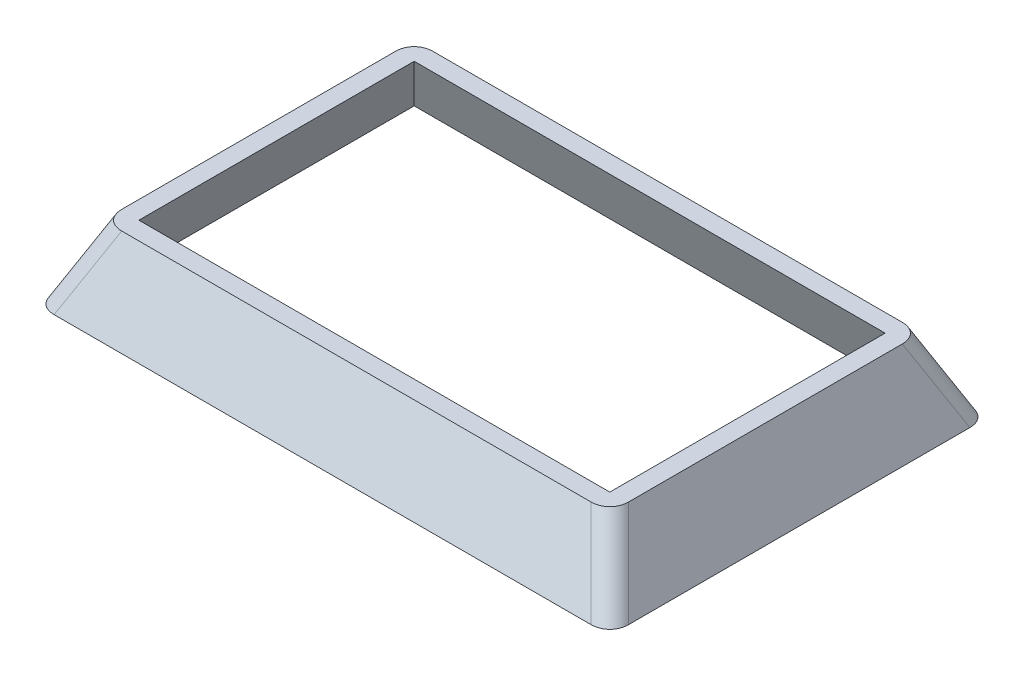
from build123d import *

# Parameters (mm, degrees)
ESQUISSE2_W        = 55.5
ESQUISSE2_H        = 36.6
ESQUISSE2_W_2      = 45.5
ESQUISSE2_H_2      = 26.6
BOSS_EXTRU_1_DEPTH = 7
CONG_3_R           = 2


with BuildPart() as part:
    # Esquisse2 → Boss.-Extru.1 (new body)
    with BuildSketch(Plane(origin=(0, 0, 0), x_dir=(1, 0, 0), z_dir=(0, 1, 0))):
        Rectangle(ESQUISSE2_W, ESQUISSE2_H)
        Rectangle(ESQUISSE2_W_2, ESQUISSE2_H_2, mode=Mode.SUBTRACT)
    extrude(amount=BOSS_EXTRU_1_DEPTH)

    # Chanfrein1
    # the kernel refuses this chamfer: 7, 3.264153607 mm, written as the material it takes off along each edge
    with BuildSketch(Plane(origin=(27.75, 7, 18.3), x_dir=(0, -0.9998669641130704, 0.01631116413111024), z_dir=(-1, 0, 0)), Plane(origin=(-27.75, 7, -18.3), x_dir=(0, -0.9998669641130704, -0.01631116413111024), z_dir=(1, 0, 0))) as chanfrein1_piece_1:
        with BuildLine():
            Line((7.25473132, 0), (-0.308904716, -3.377897506))
            Line((-0.308904716, -3.377897506), (-0.448886091, -3.375613943))
            ThreePointArc((-0.448886091, -3.375613943), (-0.167567523, -1.688734801), (-0.139981375, 0.002283563))
            Line((-0.139981375, 0.002283563), (0.002283563, 0.139981375))
            ThreePointArc((0.002283563, 0.139981375), (3.628684148, 0.08082269), (7.257014883, 0.139981375))
            Line((7.257014883, 0.139981375), (7.25473132, 0))
        make_face()
    extrude(amount=55.5, mode=Mode.SUBTRACT)
    with BuildSketch(Plane(origin=(27.75, 7, -18.3), x_dir=(0.01631116413111024, -0.9998669641130704, 0), z_dir=(0, 0, 1)), Plane(origin=(-27.75, 7, 18.3), x_dir=(-0.01631116413111024, -0.9998669641130704, 0), z_dir=(0, 0, -1))) as chanfrein1_piece_2:
        with BuildLine():
            Line((7.25473132, 0), (-0.308904716, -3.377897506))
            Line((-0.308904716, -3.377897506), (-0.448886091, -3.375613943))
            ThreePointArc((-0.448886091, -3.375613943), (-0.167567523, -1.688734801), (-0.139981375, 0.002283563))
            Line((-0.139981375, 0.002283563), (0.002283563, 0.139981375))
            ThreePointArc((0.002283563, 0.139981375), (3.628684148, 0.08082269), (7.257014883, 0.139981375))
            Line((7.257014883, 0.139981375), (7.25473132, 0))
        make_face()
    extrude(amount=36.6, mode=Mode.SUBTRACT)
    with BuildSketch(Plane(origin=(22.75, 0, 13.3), x_dir=(0, 0.9998669641130704, -0.016311164131110483), z_dir=(-1, 0, 0)), Plane(origin=(-22.75, 0, -13.3), x_dir=(0, 0.9998669641130704, 0.016311164131110483), z_dir=(1, 0, 0))) as chanfrein1_piece_3:
        with BuildLine():
            Line((7.25473132, 0), (-0.308904716, -3.377897506))
            Line((-0.308904716, -3.377897506), (-0.448886091, -3.375613943))
            ThreePointArc((-0.448886091, -3.375613943), (-0.167567523, -1.688734801), (-0.139981375, 0.002283563))
            Line((-0.139981375, 0.002283563), (0.002283563, 0.139981375))
            ThreePointArc((0.002283563, 0.139981375), (3.628684148, 0.08082269), (7.257014883, 0.139981375))
            Line((7.257014883, 0.139981375), (7.25473132, 0))
        make_face()
    extrude(amount=45.5, mode=Mode.SUBTRACT)
    with BuildSketch(Plane(origin=(-22.75, 0, 13.3), x_dir=(0.01631116413111024, 0.9998669641130704, 0), z_dir=(0, 0, -1)), Plane(origin=(22.75, 0, -13.3), x_dir=(-0.01631116413111024, 0.9998669641130704, 0), z_dir=(0, 0, 1))) as chanfrein1_piece_4:
        with BuildLine():
            Line((7.25473132, 0), (-0.308904716, -3.377897506))
            Line((-0.308904716, -3.377897506), (-0.448886091, -3.375613943))
            ThreePointArc((-0.448886091, -3.375613943), (-0.167567523, -1.688734801), (-0.139981375, 0.002283563))
            Line((-0.139981375, 0.002283563), (0.002283563, 0.139981375))
            ThreePointArc((0.002283563, 0.139981375), (3.628684148, 0.08082269), (7.257014883, 0.139981375))
            Line((7.257014883, 0.139981375), (7.25473132, 0))
        make_face()
    extrude(amount=26.6, mode=Mode.SUBTRACT)
    with BuildSketch(Plane(origin=(27.75, 7, -18.3), x_dir=(0.01631116413111024, -0.9998669641130704, 0), z_dir=(0, 0, 1))) as chanfrein1_piece_5a_section:
        with BuildLine():
            Line((7.25473132, 0), (-0.308904716, -3.377897506))
            Line((-0.308904716, -3.377897506), (-0.448886091, -3.375613943))
            ThreePointArc((-0.448886091, -3.375613943), (-0.167567523, -1.688734801), (-0.139981375, 0.002283563))
            Line((-0.139981375, 0.002283563), (0.002283563, 0.139981375))
            ThreePointArc((0.002283563, 0.139981375), (3.628684148, 0.08082269), (7.257014883, 0.139981375))
            Line((7.257014883, 0.139981375), (7.25473132, 0))
        make_face()
    chanfrein1_piece_5a = extrude(amount=54.7368283, mode=Mode.PRIVATE)
    chanfrein1_piece_5a = split(chanfrein1_piece_5a, bisect_by=Plane(origin=(26.72067158, 4.632350976, 18.3), z_dir=(0, 0, 1)), keep=Keep.TOP, mode=Mode.PRIVATE)
    with BuildSketch(Plane(origin=(45.8868283, 7, 18.3), x_dir=(0, -0.9998669641130704, 0.01631116413111024), z_dir=(-1, 0, 0))) as chanfrein1_piece_5b_section:
        with BuildLine():
            Line((7.25473132, 0), (-0.308904716, -3.377897506))
            Line((-0.308904716, -3.377897506), (-0.448886091, -3.375613943))
            ThreePointArc((-0.448886091, -3.375613943), (-0.167567523, -1.688734801), (-0.139981375, 0.002283563))
            Line((-0.139981375, 0.002283563), (0.002283563, 0.139981375))
            ThreePointArc((0.002283563, 0.139981375), (3.628684148, 0.08082269), (7.257014883, 0.139981375))
            Line((7.257014883, 0.139981375), (7.25473132, 0))
        make_face()
    chanfrein1_piece_5b = extrude(amount=73.6368283, mode=Mode.PRIVATE)
    chanfrein1_piece_5b = split(chanfrein1_piece_5b, bisect_by=Plane(origin=(27.75, 4.632350976, 17.27067158), z_dir=(1, 0, 0)), keep=Keep.TOP, mode=Mode.PRIVATE)
    chanfrein1_piece_5 = chanfrein1_piece_5a & chanfrein1_piece_5b
    add(chanfrein1_piece_5, mode=Mode.SUBTRACT)
    with BuildSketch(Plane(origin=(27.75, 7, 18.3), x_dir=(0, -0.9998669641130704, 0.01631116413111024), z_dir=(-1, 0, 0))) as chanfrein1_piece_6a_section:
        with BuildLine():
            Line((7.25473132, 0), (-0.308904716, -3.377897506))
            Line((-0.308904716, -3.377897506), (-0.448886091, -3.375613943))
            ThreePointArc((-0.448886091, -3.375613943), (-0.167567523, -1.688734801), (-0.139981375, 0.002283563))
            Line((-0.139981375, 0.002283563), (0.002283563, 0.139981375))
            ThreePointArc((0.002283563, 0.139981375), (3.628684148, 0.08082269), (7.257014883, 0.139981375))
            Line((7.257014883, 0.139981375), (7.25473132, 0))
        make_face()
    chanfrein1_piece_6a = extrude(amount=73.6368283, mode=Mode.PRIVATE)
    chanfrein1_piece_6a = split(chanfrein1_piece_6a, bisect_by=Plane(origin=(-27.75, 4.632350976, 17.27067158), z_dir=(-1, 0, 0)), keep=Keep.TOP, mode=Mode.PRIVATE)
    with BuildSketch(Plane(origin=(-27.75, 7, 36.4368283), x_dir=(-0.01631116413111024, -0.9998669641130704, 0), z_dir=(0, 0, -1))) as chanfrein1_piece_6b_section:
        with BuildLine():
            Line((7.25473132, 0), (-0.308904716, -3.377897506))
            Line((-0.308904716, -3.377897506), (-0.448886091, -3.375613943))
            ThreePointArc((-0.448886091, -3.375613943), (-0.167567523, -1.688734801), (-0.139981375, 0.002283563))
            Line((-0.139981375, 0.002283563), (0.002283563, 0.139981375))
            ThreePointArc((0.002283563, 0.139981375), (3.628684148, 0.08082269), (7.257014883, 0.139981375))
            Line((7.257014883, 0.139981375), (7.25473132, 0))
        make_face()
    chanfrein1_piece_6b = extrude(amount=54.7368283, mode=Mode.PRIVATE)
    chanfrein1_piece_6b = split(chanfrein1_piece_6b, bisect_by=Plane(origin=(-26.72067158, 4.632350976, 18.3), z_dir=(0, 0, 1)), keep=Keep.TOP, mode=Mode.PRIVATE)
    chanfrein1_piece_6 = chanfrein1_piece_6a & chanfrein1_piece_6b
    add(chanfrein1_piece_6, mode=Mode.SUBTRACT)
    with BuildSketch(Plane(origin=(-27.75, 7, -18.3), x_dir=(0, -0.9998669641130704, -0.01631116413111024), z_dir=(1, 0, 0))) as chanfrein1_piece_7a_section:
        with BuildLine():
            Line((7.25473132, 0), (-0.308904716, -3.377897506))
            Line((-0.308904716, -3.377897506), (-0.448886091, -3.375613943))
            ThreePointArc((-0.448886091, -3.375613943), (-0.167567523, -1.688734801), (-0.139981375, 0.002283563))
            Line((-0.139981375, 0.002283563), (0.002283563, 0.139981375))
            ThreePointArc((0.002283563, 0.139981375), (3.628684148, 0.08082269), (7.257014883, 0.139981375))
            Line((7.257014883, 0.139981375), (7.25473132, 0))
        make_face()
    chanfrein1_piece_7a = extrude(amount=73.6368283, mode=Mode.PRIVATE)
    chanfrein1_piece_7a = split(chanfrein1_piece_7a, bisect_by=Plane(origin=(27.75, 4.632350976, -17.27067158), z_dir=(1, 0, 0)), keep=Keep.TOP, mode=Mode.PRIVATE)
    with BuildSketch(Plane(origin=(27.75, 7, -36.4368283), x_dir=(0.01631116413111024, -0.9998669641130704, 0), z_dir=(0, 0, 1))) as chanfrein1_piece_7b_section:
        with BuildLine():
            Line((7.25473132, 0), (-0.308904716, -3.377897506))
            Line((-0.308904716, -3.377897506), (-0.448886091, -3.375613943))
            ThreePointArc((-0.448886091, -3.375613943), (-0.167567523, -1.688734801), (-0.139981375, 0.002283563))
            Line((-0.139981375, 0.002283563), (0.002283563, 0.139981375))
            ThreePointArc((0.002283563, 0.139981375), (3.628684148, 0.08082269), (7.257014883, 0.139981375))
            Line((7.257014883, 0.139981375), (7.25473132, 0))
        make_face()
    chanfrein1_piece_7b = extrude(amount=54.7368283, mode=Mode.PRIVATE)
    chanfrein1_piece_7b = split(chanfrein1_piece_7b, bisect_by=Plane(origin=(26.72067158, 4.632350976, -18.3), z_dir=(0, 0, -1)), keep=Keep.TOP, mode=Mode.PRIVATE)
    chanfrein1_piece_7 = chanfrein1_piece_7a & chanfrein1_piece_7b
    add(chanfrein1_piece_7, mode=Mode.SUBTRACT)
    with BuildSketch(Plane(origin=(-45.8868283, 7, -18.3), x_dir=(0, -0.9998669641130704, -0.01631116413111024), z_dir=(1, 0, 0))) as chanfrein1_piece_8a_section:
        with BuildLine():
            Line((7.25473132, 0), (-0.308904716, -3.377897506))
            Line((-0.308904716, -3.377897506), (-0.448886091, -3.375613943))
            ThreePointArc((-0.448886091, -3.375613943), (-0.167567523, -1.688734801), (-0.139981375, 0.002283563))
            Line((-0.139981375, 0.002283563), (0.002283563, 0.139981375))
            ThreePointArc((0.002283563, 0.139981375), (3.628684148, 0.08082269), (7.257014883, 0.139981375))
            Line((7.257014883, 0.139981375), (7.25473132, 0))
        make_face()
    chanfrein1_piece_8a = extrude(amount=73.6368283, mode=Mode.PRIVATE)
    chanfrein1_piece_8a = split(chanfrein1_piece_8a, bisect_by=Plane(origin=(-27.75, 4.632350976, -17.27067158), z_dir=(-1, 0, 0)), keep=Keep.TOP, mode=Mode.PRIVATE)
    with BuildSketch(Plane(origin=(-27.75, 7, 18.3), x_dir=(-0.01631116413111024, -0.9998669641130704, 0), z_dir=(0, 0, -1))) as chanfrein1_piece_8b_section:
        with BuildLine():
            Line((7.25473132, 0), (-0.308904716, -3.377897506))
            Line((-0.308904716, -3.377897506), (-0.448886091, -3.375613943))
            ThreePointArc((-0.448886091, -3.375613943), (-0.167567523, -1.688734801), (-0.139981375, 0.002283563))
            Line((-0.139981375, 0.002283563), (0.002283563, 0.139981375))
            ThreePointArc((0.002283563, 0.139981375), (3.628684148, 0.08082269), (7.257014883, 0.139981375))
            Line((7.257014883, 0.139981375), (7.25473132, 0))
        make_face()
    chanfrein1_piece_8b = extrude(amount=54.7368283, mode=Mode.PRIVATE)
    chanfrein1_piece_8b = split(chanfrein1_piece_8b, bisect_by=Plane(origin=(-26.72067158, 4.632350976, -18.3), z_dir=(0, 0, -1)), keep=Keep.TOP, mode=Mode.PRIVATE)
    chanfrein1_piece_8 = chanfrein1_piece_8a & chanfrein1_piece_8b
    add(chanfrein1_piece_8, mode=Mode.SUBTRACT)
    with BuildSketch(Plane(origin=(40.8868283, 0, 13.3), x_dir=(0, 0.9998669641130704, -0.016311164131110483), z_dir=(-1, 0, 0))) as chanfrein1_piece_9a_section:
        with BuildLine():
            Line((7.25473132, 0), (-0.308904716, -3.377897506))
            Line((-0.308904716, -3.377897506), (-0.448886091, -3.375613943))
            ThreePointArc((-0.448886091, -3.375613943), (-0.167567523, -1.688734801), (-0.139981375, 0.002283563))
            Line((-0.139981375, 0.002283563), (0.002283563, 0.139981375))
            ThreePointArc((0.002283563, 0.139981375), (3.628684148, 0.08082269), (7.257014883, 0.139981375))
            Line((7.257014883, 0.139981375), (7.25473132, 0))
        make_face()
    chanfrein1_piece_9a = extrude(amount=63.6368283, mode=Mode.PRIVATE)
    chanfrein1_piece_9a = split(chanfrein1_piece_9a, bisect_by=Plane(origin=(22.75, 2.367649024, 14.32932842), z_dir=(1, 0, 0)), keep=Keep.TOP, mode=Mode.PRIVATE)
    with BuildSketch(Plane(origin=(22.75, 0, -13.3), x_dir=(-0.01631116413111024, 0.9998669641130704, 0), z_dir=(0, 0, 1))) as chanfrein1_piece_9b_section:
        with BuildLine():
            Line((7.25473132, 0), (-0.308904716, -3.377897506))
            Line((-0.308904716, -3.377897506), (-0.448886091, -3.375613943))
            ThreePointArc((-0.448886091, -3.375613943), (-0.167567523, -1.688734801), (-0.139981375, 0.002283563))
            Line((-0.139981375, 0.002283563), (0.002283563, 0.139981375))
            ThreePointArc((0.002283563, 0.139981375), (3.628684148, 0.08082269), (7.257014883, 0.139981375))
            Line((7.257014883, 0.139981375), (7.25473132, 0))
        make_face()
    chanfrein1_piece_9b = extrude(amount=44.7368283, mode=Mode.PRIVATE)
    chanfrein1_piece_9b = split(chanfrein1_piece_9b, bisect_by=Plane(origin=(23.77932842, 2.367649024, 13.3), z_dir=(0, 0, 1)), keep=Keep.TOP, mode=Mode.PRIVATE)
    chanfrein1_piece_9 = chanfrein1_piece_9a & chanfrein1_piece_9b
    add(chanfrein1_piece_9, mode=Mode.SUBTRACT)
    with BuildSketch(Plane(origin=(-22.75, 0, 31.4368283), x_dir=(0.01631116413111024, 0.9998669641130704, 0), z_dir=(0, 0, -1))) as chanfrein1_piece_10a_section:
        with BuildLine():
            Line((7.25473132, 0), (-0.308904716, -3.377897506))
            Line((-0.308904716, -3.377897506), (-0.448886091, -3.375613943))
            ThreePointArc((-0.448886091, -3.375613943), (-0.167567523, -1.688734801), (-0.139981375, 0.002283563))
            Line((-0.139981375, 0.002283563), (0.002283563, 0.139981375))
            ThreePointArc((0.002283563, 0.139981375), (3.628684148, 0.08082269), (7.257014883, 0.139981375))
            Line((7.257014883, 0.139981375), (7.25473132, 0))
        make_face()
    chanfrein1_piece_10a = extrude(amount=44.7368283, mode=Mode.PRIVATE)
    chanfrein1_piece_10a = split(chanfrein1_piece_10a, bisect_by=Plane(origin=(-23.77932842, 2.367649024, 13.3), z_dir=(0, 0, 1)), keep=Keep.TOP, mode=Mode.PRIVATE)
    with BuildSketch(Plane(origin=(22.75, 0, 13.3), x_dir=(0, 0.9998669641130704, -0.016311164131110483), z_dir=(-1, 0, 0))) as chanfrein1_piece_10b_section:
        with BuildLine():
            Line((7.25473132, 0), (-0.308904716, -3.377897506))
            Line((-0.308904716, -3.377897506), (-0.448886091, -3.375613943))
            ThreePointArc((-0.448886091, -3.375613943), (-0.167567523, -1.688734801), (-0.139981375, 0.002283563))
            Line((-0.139981375, 0.002283563), (0.002283563, 0.139981375))
            ThreePointArc((0.002283563, 0.139981375), (3.628684148, 0.08082269), (7.257014883, 0.139981375))
            Line((7.257014883, 0.139981375), (7.25473132, 0))
        make_face()
    chanfrein1_piece_10b = extrude(amount=63.6368283, mode=Mode.PRIVATE)
    chanfrein1_piece_10b = split(chanfrein1_piece_10b, bisect_by=Plane(origin=(-22.75, 2.367649024, 14.32932842), z_dir=(-1, 0, 0)), keep=Keep.TOP, mode=Mode.PRIVATE)
    chanfrein1_piece_10 = chanfrein1_piece_10a & chanfrein1_piece_10b
    add(chanfrein1_piece_10, mode=Mode.SUBTRACT)
    with BuildSketch(Plane(origin=(-22.75, 0, 13.3), x_dir=(0.01631116413111024, 0.9998669641130704, 0), z_dir=(0, 0, -1))) as chanfrein1_piece_11a_section:
        with BuildLine():
            Line((7.25473132, 0), (-0.308904716, -3.377897506))
            Line((-0.308904716, -3.377897506), (-0.448886091, -3.375613943))
            ThreePointArc((-0.448886091, -3.375613943), (-0.167567523, -1.688734801), (-0.139981375, 0.002283563))
            Line((-0.139981375, 0.002283563), (0.002283563, 0.139981375))
            ThreePointArc((0.002283563, 0.139981375), (3.628684148, 0.08082269), (7.257014883, 0.139981375))
            Line((7.257014883, 0.139981375), (7.25473132, 0))
        make_face()
    chanfrein1_piece_11a = extrude(amount=44.7368283, mode=Mode.PRIVATE)
    chanfrein1_piece_11a = split(chanfrein1_piece_11a, bisect_by=Plane(origin=(-23.77932842, 2.367649024, -13.3), z_dir=(0, 0, -1)), keep=Keep.TOP, mode=Mode.PRIVATE)
    with BuildSketch(Plane(origin=(-40.8868283, 0, -13.3), x_dir=(0, 0.9998669641130704, 0.016311164131110483), z_dir=(1, 0, 0))) as chanfrein1_piece_11b_section:
        with BuildLine():
            Line((7.25473132, 0), (-0.308904716, -3.377897506))
            Line((-0.308904716, -3.377897506), (-0.448886091, -3.375613943))
            ThreePointArc((-0.448886091, -3.375613943), (-0.167567523, -1.688734801), (-0.139981375, 0.002283563))
            Line((-0.139981375, 0.002283563), (0.002283563, 0.139981375))
            ThreePointArc((0.002283563, 0.139981375), (3.628684148, 0.08082269), (7.257014883, 0.139981375))
            Line((7.257014883, 0.139981375), (7.25473132, 0))
        make_face()
    chanfrein1_piece_11b = extrude(amount=63.6368283, mode=Mode.PRIVATE)
    chanfrein1_piece_11b = split(chanfrein1_piece_11b, bisect_by=Plane(origin=(-22.75, 2.367649024, -14.32932842), z_dir=(-1, 0, 0)), keep=Keep.TOP, mode=Mode.PRIVATE)
    chanfrein1_piece_11 = chanfrein1_piece_11a & chanfrein1_piece_11b
    add(chanfrein1_piece_11, mode=Mode.SUBTRACT)
    with BuildSketch(Plane(origin=(22.75, 0, -31.4368283), x_dir=(-0.01631116413111024, 0.9998669641130704, 0), z_dir=(0, 0, 1))) as chanfrein1_piece_12a_section:
        with BuildLine():
            Line((7.25473132, 0), (-0.308904716, -3.377897506))
            Line((-0.308904716, -3.377897506), (-0.448886091, -3.375613943))
            ThreePointArc((-0.448886091, -3.375613943), (-0.167567523, -1.688734801), (-0.139981375, 0.002283563))
            Line((-0.139981375, 0.002283563), (0.002283563, 0.139981375))
            ThreePointArc((0.002283563, 0.139981375), (3.628684148, 0.08082269), (7.257014883, 0.139981375))
            Line((7.257014883, 0.139981375), (7.25473132, 0))
        make_face()
    chanfrein1_piece_12a = extrude(amount=44.7368283, mode=Mode.PRIVATE)
    chanfrein1_piece_12a = split(chanfrein1_piece_12a, bisect_by=Plane(origin=(23.77932842, 2.367649024, -13.3), z_dir=(0, 0, -1)), keep=Keep.TOP, mode=Mode.PRIVATE)
    with BuildSketch(Plane(origin=(-22.75, 0, -13.3), x_dir=(0, 0.9998669641130704, 0.016311164131110483), z_dir=(1, 0, 0))) as chanfrein1_piece_12b_section:
        with BuildLine():
            Line((7.25473132, 0), (-0.308904716, -3.377897506))
            Line((-0.308904716, -3.377897506), (-0.448886091, -3.375613943))
            ThreePointArc((-0.448886091, -3.375613943), (-0.167567523, -1.688734801), (-0.139981375, 0.002283563))
            Line((-0.139981375, 0.002283563), (0.002283563, 0.139981375))
            ThreePointArc((0.002283563, 0.139981375), (3.628684148, 0.08082269), (7.257014883, 0.139981375))
            Line((7.257014883, 0.139981375), (7.25473132, 0))
        make_face()
    chanfrein1_piece_12b = extrude(amount=63.6368283, mode=Mode.PRIVATE)
    chanfrein1_piece_12b = split(chanfrein1_piece_12b, bisect_by=Plane(origin=(22.75, 2.367649024, -14.32932842), z_dir=(1, 0, 0)), keep=Keep.TOP, mode=Mode.PRIVATE)
    chanfrein1_piece_12 = chanfrein1_piece_12a & chanfrein1_piece_12b
    add(chanfrein1_piece_12, mode=Mode.SUBTRACT)

    # Congé3
    cong_3_edges = [part.edges().sort_by_distance(p)[0] for p in [
        (-26.117923196, 3.5, -16.667923196),
        (26.117923196, 3.5, -16.667923196),
        (-26.117923196, 3.5, 16.667923196),
        (26.117923196, 3.5, 16.667923196),
    ]]
    fillet(cong_3_edges, radius=CONG_3_R)


solid = part.part
